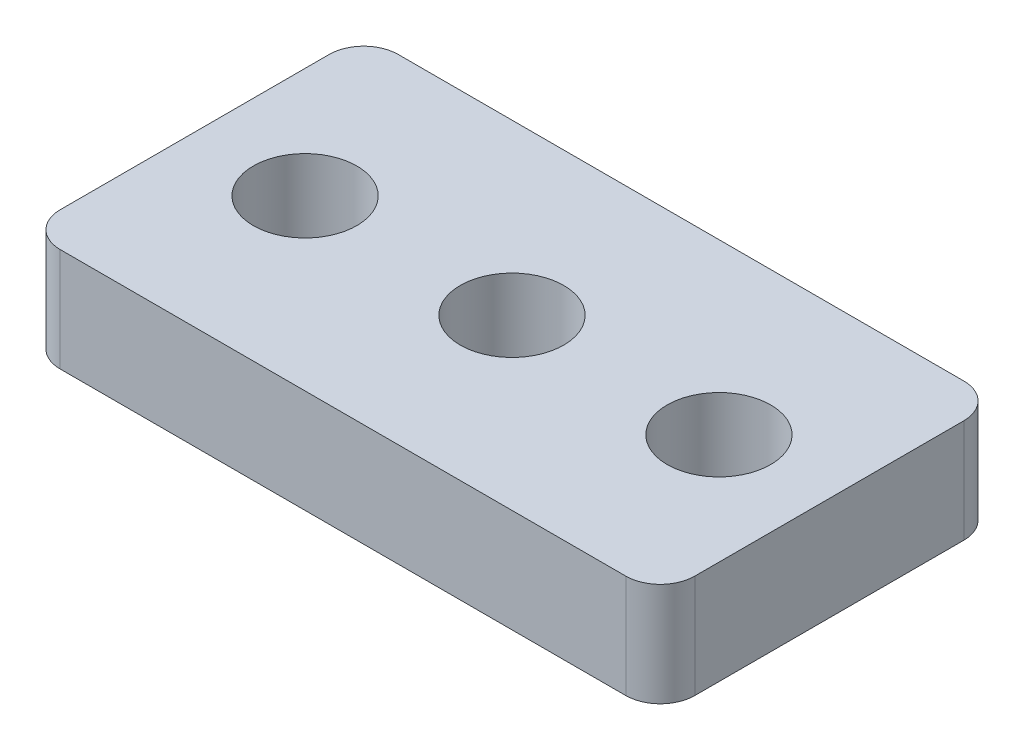
from build123d import *

# Parameters (mm, degrees)
SKETCH4_W           = 18.4
SKETCH4_H           = 9.79999981
SKETCH4_R           = 1.5
BOSS_EXTRUDE5_DEPTH = 3
FILLET4_R           = 1


with BuildPart() as part:
    # Sketch4 → Boss-Extrude5 (new body)
    with BuildSketch(Plane(origin=(0, 0, 0), x_dir=(1, 0, 0), z_dir=(0, 1, 0))):
        Rectangle(SKETCH4_W, SKETCH4_H)
        with Locations((-6.0000007, 0)):
            Circle(SKETCH4_R, mode=Mode.SUBTRACT)
        with Locations((6.0000007, 0)):
            Circle(SKETCH4_R, mode=Mode.SUBTRACT)
        Circle(SKETCH4_R, mode=Mode.SUBTRACT)
    extrude(amount=BOSS_EXTRUDE5_DEPTH)

    # Fillet4
    fillet4_edges = [part.edges().sort_by_distance(p)[0] for p in [
        (-9.2, 1.5, 4.899999905),
        (9.2, 1.5, 4.899999905),
        (9.2, 1.5, -4.899999905),
        (-9.2, 1.5, -4.899999905),
    ]]
    fillet(fillet4_edges, radius=FILLET4_R)


solid = part.part
